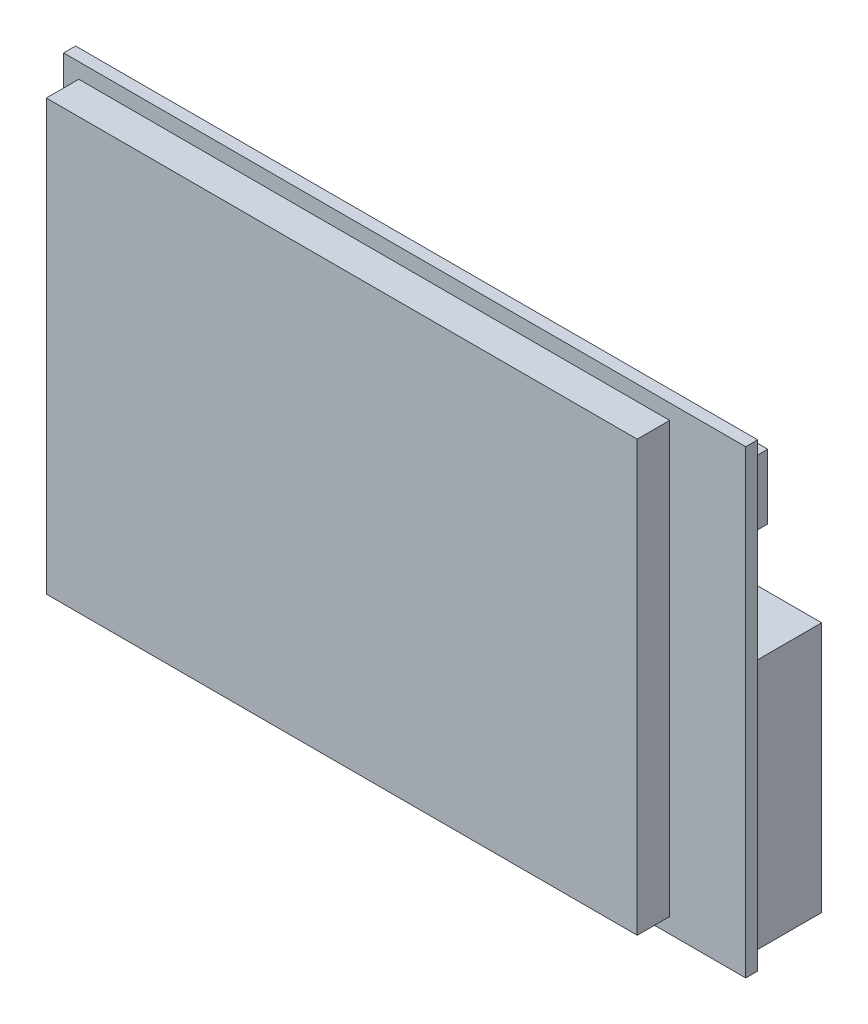
from build123d import *

# Parameters (mm, degrees)
SKETCH1_W           = 89.7
SKETCH1_H           = 60.5
BOSS_EXTRUDE1_DEPTH = 1.5748
SKETCH2_W           = 77.7
SKETCH2_H           = 56.5
BOSS_EXTRUDE2_DEPTH = 4.27
SKETCH3_W           = 8.96
SKETCH3_H           = 33
BOSS_EXTRUDE3_DEPTH = 8.87
SKETCH4_W           = 5.23
SKETCH4_H           = 8.53
BOSS_EXTRUDE4_DEPTH = 4


with BuildPart() as part:
    # Sketch1 → Boss-Extrude1 (new body)
    with BuildSketch(Plane(origin=(0, 0, 0), x_dir=(-1, 0, 0), z_dir=(0, 0, -1))):
        with Locations((-1.15, -0.25)):
            Rectangle(SKETCH1_W, SKETCH1_H)
    extrude(amount=BOSS_EXTRUDE1_DEPTH)

    # Sketch2 → Boss-Extrude2 (add)
    with BuildSketch(Plane(origin=(0, 0, 0), x_dir=(-1, 0, 0), z_dir=(0, 0, -1))):
        with Locations((2.85, -0.25)):
            Rectangle(SKETCH2_W, SKETCH2_H)
    extrude(amount=-BOSS_EXTRUDE2_DEPTH)

    # Sketch3 → Boss-Extrude3 (add)
    with BuildSketch(Plane.XY.offset(-1.5748)):
        with Locations((41.061606148, -12)):
            Rectangle(SKETCH3_W, SKETCH3_H)
    extrude(amount=-BOSS_EXTRUDE3_DEPTH)

    # Sketch4 → Boss-Extrude4 (add)
    with BuildSketch(Plane.XY.offset(-1.5748)):
        with Locations((40.702784247, 21.329047992)):
            Rectangle(SKETCH4_W, SKETCH4_H)
    extrude(amount=-BOSS_EXTRUDE4_DEPTH)


solid = part.part
